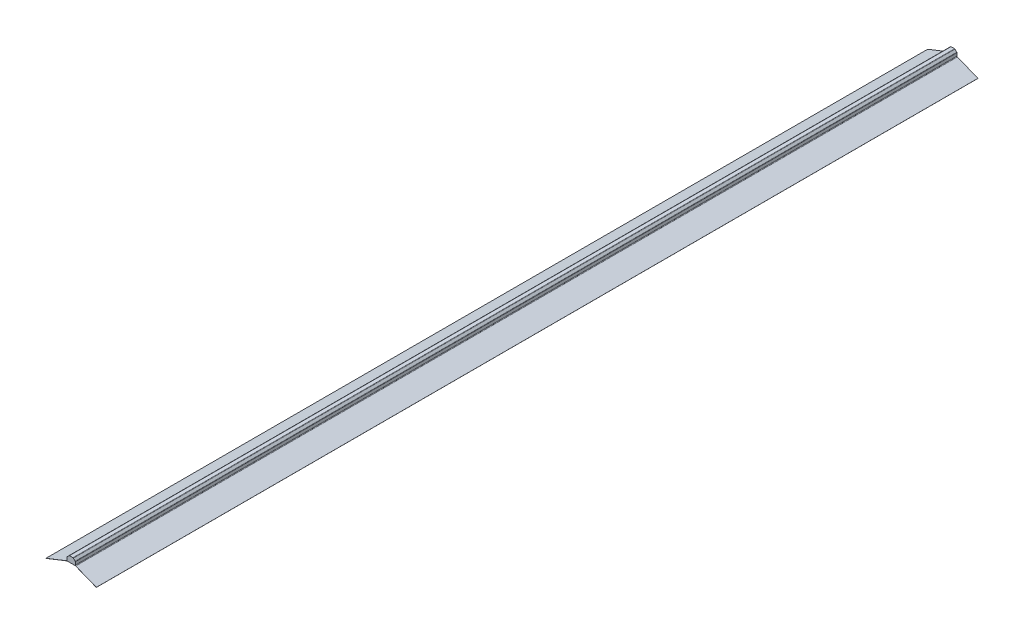
from build123d import *

# Parameters (mm, degrees)
BOSS_EXTRUDE1_DEPTH      = 3962.146
BOSS_EXTRUDE1_DEPTH_BACK = 3962.146
CHAMFER1_SIZE            = 19.05
FILLET1_R                = 6.35
SHELL1_START             = -3961.3332
SHELL1_DEPTH             = 7922.6664


# Read off the part's stored shape, not the designer's step: Shell1
with BuildPart() as part:
    # Sketch1 → Boss-Extrude1 (new, two sides: drawn at the far end of the back side and taken through both)
    with BuildSketch(Plane.XY.offset(-BOSS_EXTRUDE1_DEPTH_BACK)):
        Polygon((-37.157189229, 0.8128), (-37.157189229, 51.6128), (37.157189229, 51.6128), (37.157189229, 0.8128), (226.334430672, -73.786204522), (226.036261318, -74.542338687), (37.00272, 0), (-37.00272, 0), (-226.036261318, -74.542338687), (-226.334430672, -73.786204522), align=None)
    extrude(amount=BOSS_EXTRUDE1_DEPTH + BOSS_EXTRUDE1_DEPTH_BACK)

    # Chamfer1
    chamfer1_edges = [part.edges().sort_by_distance(p)[0] for p in [
        (-37.157189229, 51.6128, 0),
        (37.157189229, 51.6128, 0),
    ]]
    chamfer(chamfer1_edges, length=CHAMFER1_SIZE)

    # Fillet1
    fillet1_edges = [part.edges().sort_by_distance(p)[0] for p in [
        (-37.157189229, 0.8128, 0),
        (37.157189229, 0.8128, 0),
        (37.157189229, 32.5628, 0),
        (-18.107189229, 51.6128, 0),
        (18.107189229, 51.6128, 0),
        (-37.157189229, 32.5628, 0),
    ]]
    fillet(fillet1_edges, radius=FILLET1_R)

    # Shell1 outline → Shell1 (cut)
    with BuildSketch(Plane.XY.offset(SHELL1_START)):
        with BuildLine():
            ThreePointArc((-36.344389229, 5.13465814), (-36.90880265, 2.347724631), (-38.513093754, 0))
            Line((-38.513093754, 0), (38.513093754, 0))
            ThreePointArc((38.513093754, 0), (36.90880265, 2.347724631), (36.344389229, 5.13465814))
            Line((36.344389229, 5.13465814), (36.344389229, 29.932543879))
            ThreePointArc((36.344389229, 29.932543879), (35.922894977, 32.051538581), (34.722580898, 33.847935548))
            Line((34.722580898, 33.847935548), (19.392324777, 49.178191669))
            ThreePointArc((19.392324777, 49.178191669), (17.59592781, 50.378505747), (15.476933108, 50.8))
            Line((15.476933108, 50.8), (-15.476933108, 50.8))
            ThreePointArc((-15.476933108, 50.8), (-17.59592781, 50.378505747), (-19.392324777, 49.178191669))
            Line((-19.392324777, 49.178191669), (-34.722580898, 33.847935548))
            ThreePointArc((-34.722580898, 33.847935548), (-35.922894977, 32.051538581), (-36.344389229, 29.932543879))
            Line((-36.344389229, 29.932543879), (-36.344389229, 5.13465814))
        make_face()
    extrude(amount=SHELL1_DEPTH, mode=Mode.SUBTRACT)


solid = part.part
